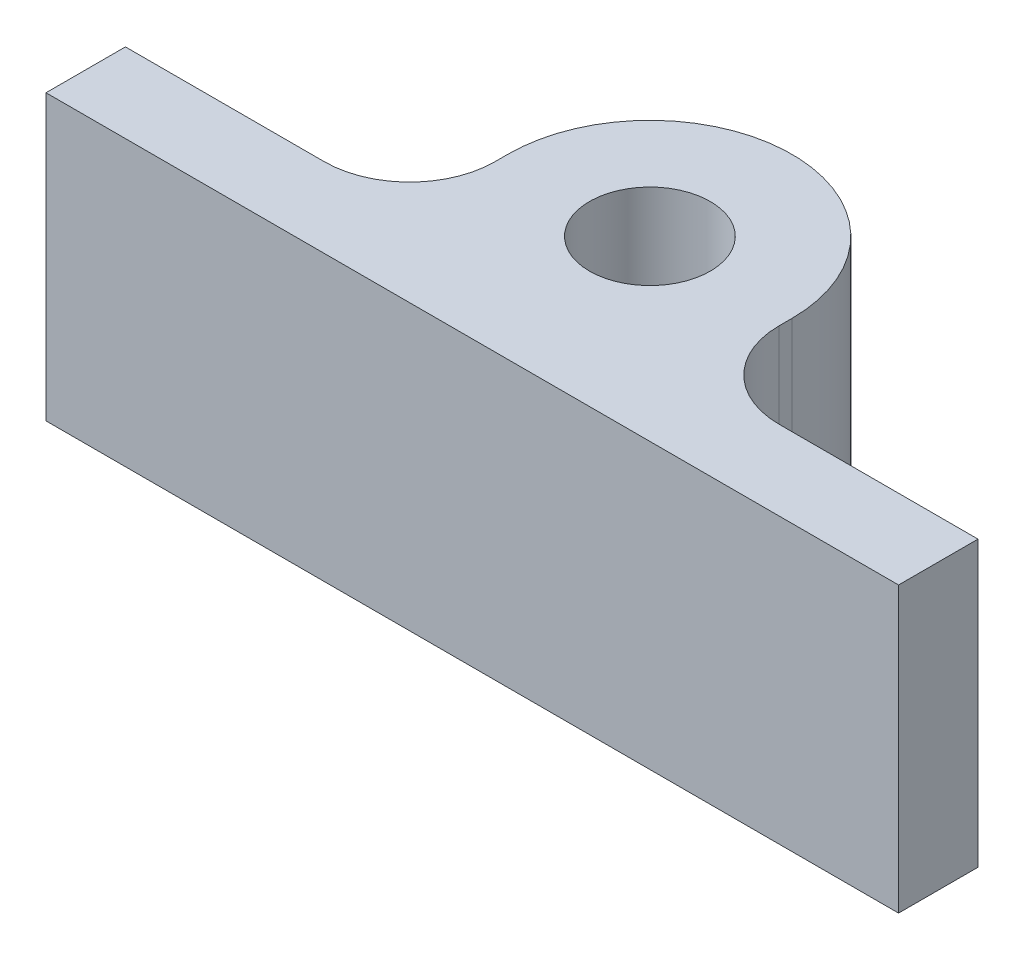
from build123d import *

# Parameters (mm, degrees)
SKETCH1_R           = 4.25
BOSS_EXTRUDE1_DEPTH = 20


with BuildPart() as part:
    # Sketch1 → Boss-Extrude1 (new body)
    with BuildSketch(Plane(origin=(0, 0, 0), x_dir=(1, 0, 0), z_dir=(0, 1, 0))):
        with BuildLine():
            Line((30, -12.5), (-30, -12.5))
            Line((-30, -12.5), (-30, -6.90963498))
            Line((-30, -6.90963498), (-16, -6.90963498))
            ThreePointArc((-16, -6.90963498), (-11.757359313, -5.152275667), (-10, -0.90963498))
            Line((-10, -0.90963498), (-10, 0))
            ThreePointArc((-10, 0), (0, 10), (10, 0))
            Line((10, 0), (10, -0.90963498))
            ThreePointArc((10, -0.90963498), (11.757359313, -5.152275667), (16, -6.90963498))
            Line((16, -6.90963498), (30, -6.90963498))
            Line((30, -6.90963498), (30, -12.5))
        make_face()
        Circle(SKETCH1_R, mode=Mode.SUBTRACT)
    extrude(amount=BOSS_EXTRUDE1_DEPTH)


solid = part.part
